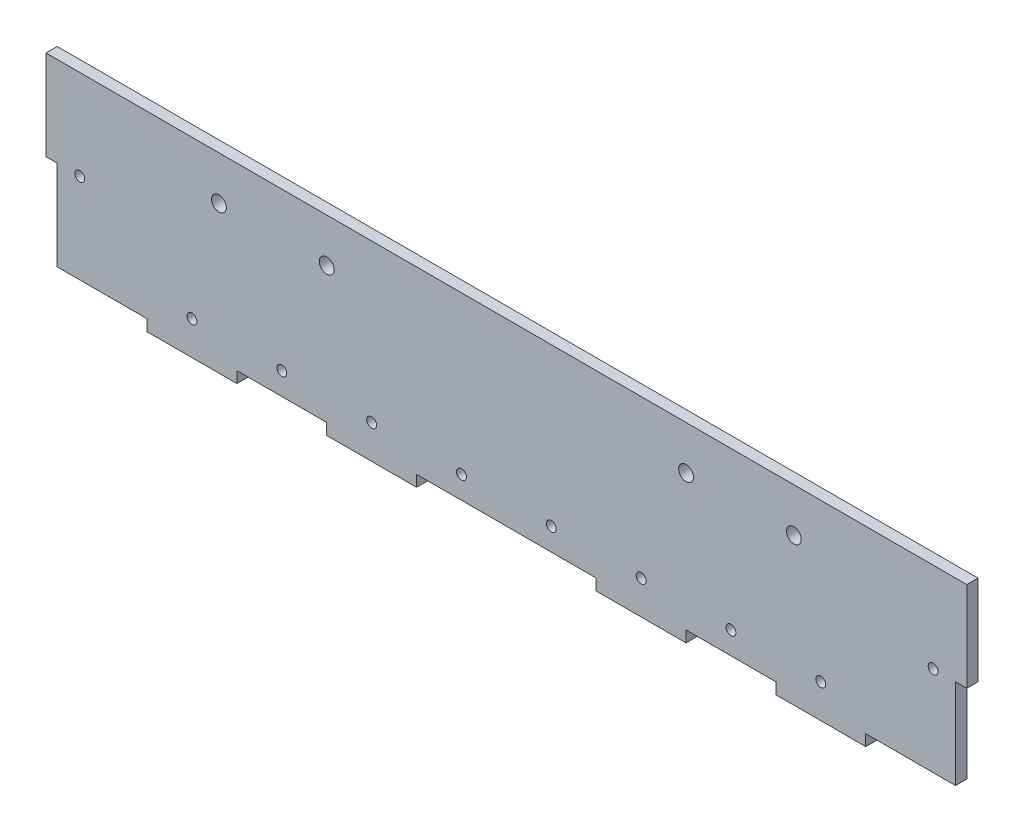
from build123d import *

# Parameters (mm, degrees)
SKETCH_1_R          = 2.2
EXTRUDE_1_DEPTH     = 5
SKETCH_2_W          = 410
SKETCH_2_H          = 226.105378696
CUT_EXTRUDE_2_DEPTH = 5
SKETCH_4_W          = 410
SKETCH_4_H          = 19.486670542
EXTRUDE_3_DEPTH     = 5
SKETCH_5_R          = 3.3
CUT_EXTRUDE_3_DEPTH = 10


with BuildPart() as part:
    # 草图1 → 凸台-拉伸1 (new body)
    with BuildSketch(Plane.XY):
        Polygon((200, 150), (-200, 150), (-200, 110), (-205, 110), (-205, 70), (-200, 70), (-200, 30), (-205, 30), (-205, -30), (-200, -30), (-200, -70), (-205, -70), (-205, -110), (-200, -110), (-200, -150), (-160, -150), (-160, -155), (-120, -155), (-120, -150), (-80, -150), (-80, -155), (-40, -155), (-40, -150), (40, -150), (40, -155), (80, -155), (80, -150), (120, -150), (120, -155), (160, -155), (160, -150), (200, -150), (200, -110), (205, -110), (205, -70), (200, -70), (200, -30), (205, -30), (205, 30), (200, 30), (200, 70), (205, 70), (205, 110), (200, 110), align=None)
        with Locations((-140, -140)):
            Circle(SKETCH_1_R, mode=Mode.SUBTRACT)
        with Locations((-190, -110)):
            Circle(SKETCH_1_R, mode=Mode.SUBTRACT)
        with Locations((-100, -140)):
            Circle(SKETCH_1_R, mode=Mode.SUBTRACT)
        with Locations((-60, -140)):
            Circle(SKETCH_1_R, mode=Mode.SUBTRACT)
        with Locations((-20, -140)):
            Circle(SKETCH_1_R, mode=Mode.SUBTRACT)
        with Locations((-190, -70)):
            Circle(SKETCH_1_R, mode=Mode.SUBTRACT)
        with Locations((-190, -30)):
            Circle(SKETCH_1_R, mode=Mode.SUBTRACT)
        with Locations((20, -140)):
            Circle(SKETCH_1_R, mode=Mode.SUBTRACT)
        with Locations((60, -140)):
            Circle(SKETCH_1_R, mode=Mode.SUBTRACT)
        with Locations((100, -140)):
            Circle(SKETCH_1_R, mode=Mode.SUBTRACT)
        with Locations((140, -140)):
            Circle(SKETCH_1_R, mode=Mode.SUBTRACT)
        with Locations((190, -110)):
            Circle(SKETCH_1_R, mode=Mode.SUBTRACT)
        with Locations((190, -70)):
            Circle(SKETCH_1_R, mode=Mode.SUBTRACT)
        with Locations((190, -30)):
            Circle(SKETCH_1_R, mode=Mode.SUBTRACT)
        with Locations((-190, 30)):
            Circle(SKETCH_1_R, mode=Mode.SUBTRACT)
        with Locations((-190, 70)):
            Circle(SKETCH_1_R, mode=Mode.SUBTRACT)
        with Locations((-190, 110)):
            Circle(SKETCH_1_R, mode=Mode.SUBTRACT)
        with Locations((190, 30)):
            Circle(SKETCH_1_R, mode=Mode.SUBTRACT)
        with Locations((190, 70)):
            Circle(SKETCH_1_R, mode=Mode.SUBTRACT)
        with Locations((190, 110)):
            Circle(SKETCH_1_R, mode=Mode.SUBTRACT)
    extrude(amount=EXTRUDE_1_DEPTH)

    # 草图2 → 切除-拉伸2 (cut)
    with BuildSketch(Plane.XY.offset(5)):
        with Locations((0, 43.052689348)):
            Rectangle(SKETCH_2_W, SKETCH_2_H)
    extrude(amount=-CUT_EXTRUDE_2_DEPTH, mode=Mode.SUBTRACT)

    # 草图4 → 凸台-拉伸3 (add)
    with BuildSketch(Plane.XY.offset(5)):
        with Locations((0, -79.743335271)):
            Rectangle(SKETCH_4_W, SKETCH_4_H)
    extrude(amount=-EXTRUDE_3_DEPTH)

    # 草图5 → 切除-拉伸3 (cut)
    with BuildSketch(Plane(origin=(0, 0, 0), x_dir=(-1, 0, 0), z_dir=(0, 0, -1))):
        with Locations((-80, -89.5)):
            Circle(SKETCH_5_R)
        with Locations((-128, -89.5)):
            Circle(SKETCH_5_R)
        with Locations((128, -89.5)):
            Circle(SKETCH_5_R)
        with Locations((80, -89.5)):
            Circle(SKETCH_5_R)
    extrude(amount=-CUT_EXTRUDE_3_DEPTH, mode=Mode.SUBTRACT)


solid = part.part
